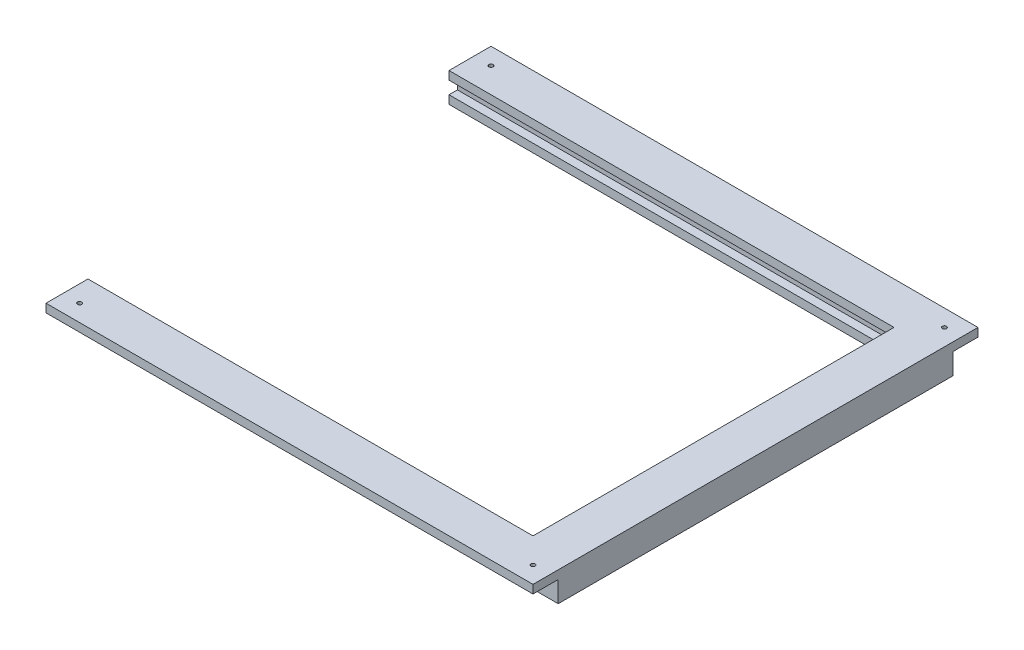
from build123d import *

# Parameters (mm, degrees)
EXTRUDE_2_DEPTH             = 10
EXTRUDE_3_DEPTH             = 15
SKETCH_4_R                  = 2.5
CUT_EXTRUDE_1_DEPTH         = 807.903686949
PATTERN_LINEAR_2_COUNT      = 2
PATTERN_LINEAR_2_PITCH      = 540
PATTERN_LINEAR_2_COUNT_DIR2 = 2
PATTERN_LINEAR_2_PITCH_DIR2 = 490
EXTRUDE_4_DEPTH             = 10


with BuildPart() as part:
    # Эскиз1 → Бобышка-Вытянуть2 (new body)
    with BuildSketch(Plane(origin=(0, 0, 0), x_dir=(1, 0, 0), z_dir=(0, 1, 0))):
        Polygon((50, -77.921508101), (50, -607.921508101), (-530, -607.921508101), (-530, -557.921508101), (0, -557.921508101), (0, -127.921508101), (-530, -127.921508101), (-530, -77.921508101), align=None)
    extrude(amount=EXTRUDE_2_DEPTH)

    # Эскиз2 → Бобышка-Вытянуть3 (add)
    with BuildSketch(Plane.XZ):
        Polygon((50, 577.921508101), (50, 107.921508101), (-530, 107.921508101), (-530, 117.921508101), (10, 117.921508101), (10, 567.921508101), (-530, 567.921508101), (-530, 577.921508101), align=None)
    extrude(amount=EXTRUDE_3_DEPTH)

    # Эскиз4 → Вырез-Вытянуть1 (cut, through all)
    with BuildSketch(Plane(origin=(0, 10, 0), x_dir=(1, 0, 0), z_dir=(0, 1, 0))):
        with Locations((-510, -97.921508101)):
            Circle(SKETCH_4_R)
    cut_extrude_1 = extrude(amount=-CUT_EXTRUDE_1_DEPTH, mode=Mode.SUBTRACT)

    # Линейный массив2: Cut-Extrude 1 2 × 2
    with Locations(*[(i * PATTERN_LINEAR_2_PITCH, 0, j * PATTERN_LINEAR_2_PITCH_DIR2) for i in range(PATTERN_LINEAR_2_COUNT) for j in range(PATTERN_LINEAR_2_COUNT_DIR2) if (i, j) != (0, 0)]):
        add(cut_extrude_1, mode=Mode.SUBTRACT)

    # Эскиз5 → Бобышка-Вытянуть4 (add)
    with BuildSketch(Plane.XZ.offset(15)):
        Polygon((50, 577.921508101), (-530, 577.921508101), (-530, 557.921508101), (0, 557.921508101), (0, 127.921508101), (-530, 127.921508101), (-530, 107.921508101), (50, 107.921508101), align=None)
    extrude(amount=EXTRUDE_4_DEPTH)


solid = part.part
